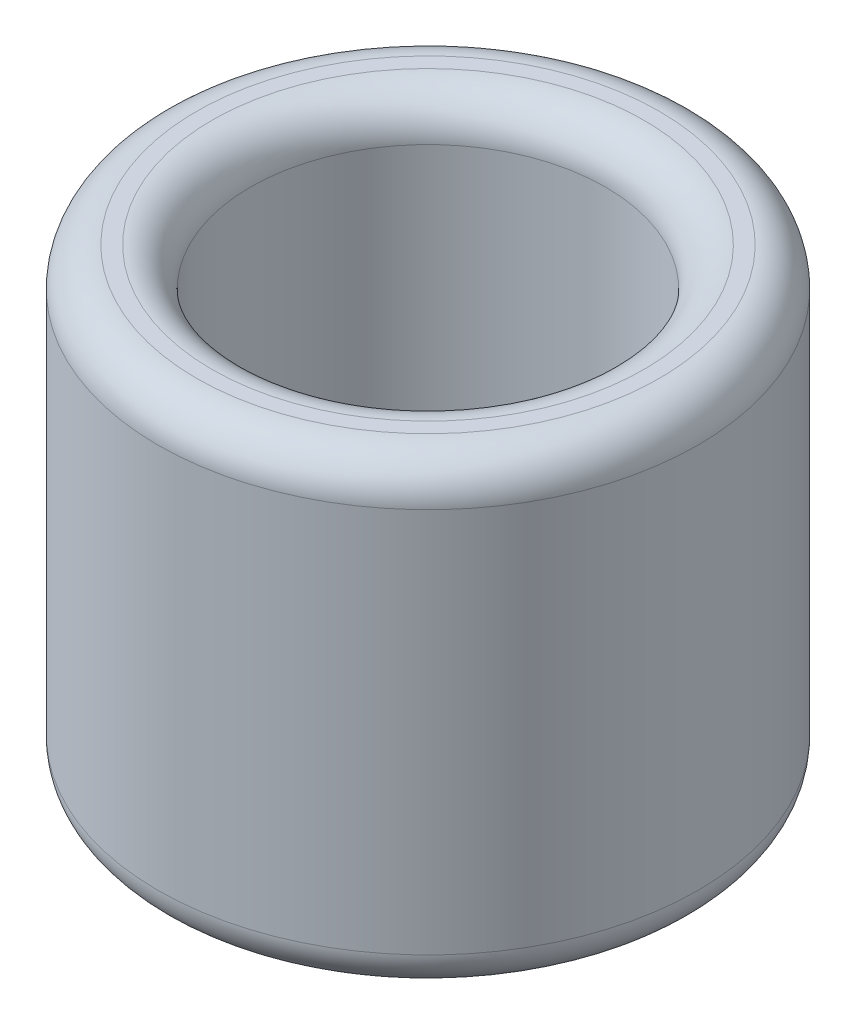
from build123d import *

# Parameters (mm, degrees)
SKETCH1_R           = 1.75
SKETCH1_R_2         = 1.15
BOSS_EXTRUDE1_DEPTH = 3
FILLET1_R           = 0.25


with BuildPart() as part:
    # Sketch1 → Boss-Extrude1 (new body)
    with BuildSketch(Plane(origin=(0, 0, 0), x_dir=(1, 0, 0), z_dir=(0, 1, 0))):
        Circle(SKETCH1_R)
        Circle(SKETCH1_R_2, mode=Mode.SUBTRACT)
    extrude(amount=BOSS_EXTRUDE1_DEPTH)

    # Fillet1
    fillet1_edges = [part.edges().sort_by_distance(p)[0] for p in [
        (-1.15, 0, 0),
        (-1.75, 0, 0),
        (-1.15, 3, 0),
        (-1.75, 3, 0),
    ]]
    fillet(fillet1_edges, radius=FILLET1_R)


solid = part.part
